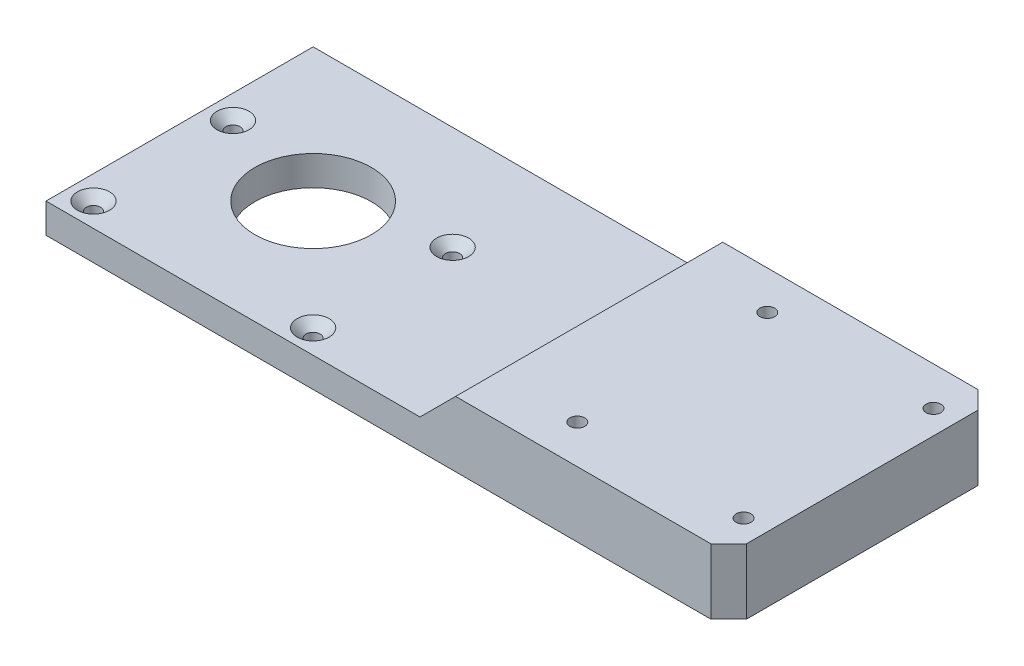
from build123d import *

# Parameters (mm, degrees)
SKETCH1_W                                           = 115
SKETCH1_H                                           = 45
BOSS_EXTRUDE1_DEPTH                                 = 5
CUT_EXTRUDE1_REACH                                  = 119.287
SKETCH2_R                                           = 9.8171
CSK_FOR_M2_COUNTERSUNK_FLAT_HEAD_SCREW1_D           = 2.4
CSK_FOR_M2_COUNTERSUNK_FLAT_HEAD_SCREW1_CSINK_D     = 5.4
CSK_FOR_M2_COUNTERSUNK_FLAT_HEAD_SCREW1_CSINK_ANGLE = 90
SKETCH13_W                                          = 52
SKETCH13_H                                          = 45
BOSS_EXTRUDE4_DEPTH                                 = 6
CHAMFER2_SIZE                                       = 6
M3_TAPPED_HOLE1_D                                   = 2.5
CHAMFER1_SIZE                                       = 3


with BuildPart() as part:
    # Sketch1 → Boss-Extrude1 (new body)
    with BuildSketch(Plane(origin=(0, 0, 0), x_dir=(1, 0, 0), z_dir=(0, 1, 0))):
        with Locations((57.5, 0)):
            Rectangle(SKETCH1_W, SKETCH1_H)
    extrude(amount=BOSS_EXTRUDE1_DEPTH)

    # Sketch2 → Cut-Extrude1 (cut, up to next)
    with BuildSketch(Plane(origin=(0, 5, 0), x_dir=(1, 0, 0), z_dir=(0, 1, 0)), mode=Mode.PRIVATE) as cut_extrude1_sk1:
        with Locations(Location((22.5, 0, 0), (0, 0, 270))):
            Circle(SKETCH2_R)
    cut_extrude1_tool1 = extrude(cut_extrude1_sk1.sketch, amount=-CUT_EXTRUDE1_REACH, mode=Mode.PRIVATE) & part.part
    add(cut_extrude1_tool1.solids().sort_by_distance((22.5, 5, 0))[0], mode=Mode.SUBTRACT)

    # CSK for M2 Countersunk Flat Head Screw1 (through all)
    with Locations(Plane(origin=(0, 5, 0), x_dir=(1, 0, 0), z_dir=(0, 1, 0))):
        with Locations((4, -18.5), (41, -18.5), (41, 5), (4, 5)):
            CounterSinkHole(CSK_FOR_M2_COUNTERSUNK_FLAT_HEAD_SCREW1_D / 2, CSK_FOR_M2_COUNTERSUNK_FLAT_HEAD_SCREW1_CSINK_D / 2, counter_sink_angle=CSK_FOR_M2_COUNTERSUNK_FLAT_HEAD_SCREW1_CSINK_ANGLE)

    # Sketch13 → Boss-Extrude4 (add)
    with BuildSketch(Plane(origin=(0, 5, 0), x_dir=(1, 0, 0), z_dir=(0, 1, 0))):
        with Locations((89, 0)):
            Rectangle(SKETCH13_W, SKETCH13_H)
    extrude(amount=BOSS_EXTRUDE4_DEPTH)

    # Chamfer2
    chamfer2_edges = [part.edges().sort_by_distance(p)[0] for p in [
        (63, 11, 0),
    ]]
    chamfer(chamfer2_edges, length=CHAMFER2_SIZE - 0.0001)  # a hair under: the kernel refuses the full size

    # M3 Tapped Hole1 (through all)
    with Locations(Plane(origin=(0, 11, 0), x_dir=(1, 0, 0), z_dir=(0, 1, 0))):
        with Locations((83, 16), (111, 16), (83, -16), (111, -16)):
            Hole(M3_TAPPED_HOLE1_D / 2)

    # Chamfer1
    chamfer1_edges = [part.edges().sort_by_distance(p)[0] for p in [
        (115, 5.5, -22.5),
        (115, 5.5, 22.5),
    ]]
    chamfer(chamfer1_edges, length=CHAMFER1_SIZE)


solid = part.part
